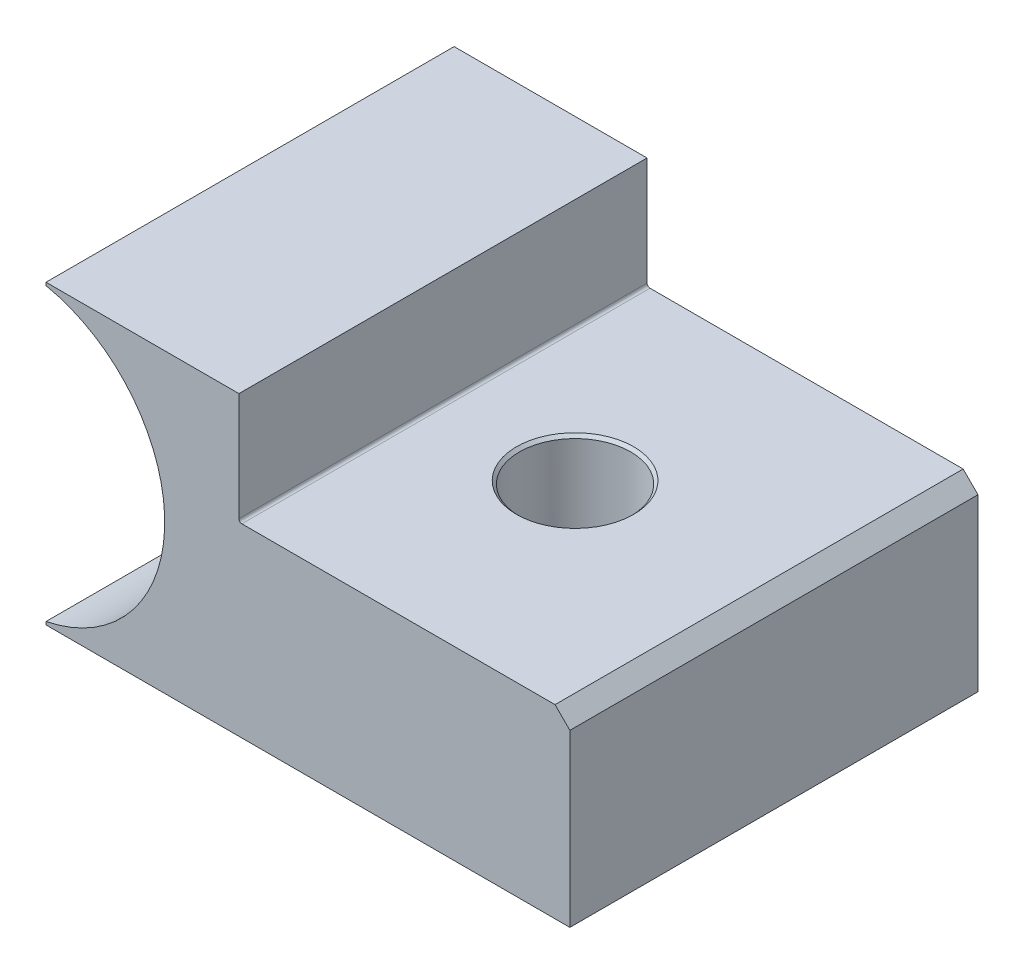
from build123d import *

# Parameters (mm, degrees)
BOSS_EXTRUDE1_DEPTH          = 34.925
F_3_8_0_375_DIAMETER_HOLE1_D = 9.525
CHAMFER1_SIZE                = 1.27
CHAMFER2_SIZE                = 0.254
FILLET1_R                    = 0.254


with BuildPart() as part:
    # Sketch1 → Boss-Extrude1 (new body)
    with BuildSketch(Plane.XY):
        with BuildLine():
            Line((2.54, 0), (47.371, 0))
            Line((47.371, 0), (47.371, 15.875))
            Line((47.371, 15.875), (19.05, 15.875))
            Line((19.05, 15.875), (19.05, 25.4))
            Line((19.05, 25.4), (2.54, 25.4))
            Line((2.54, 25.4), (2.54, 25.143407893))
            ThreePointArc((2.54, 25.143407893), (12.7, 12.7), (2.54, 0.256592107))
            Line((2.54, 0.256592107), (2.54, 0))
        make_face()
    extrude(amount=BOSS_EXTRUDE1_DEPTH)

    # 3/8 (0.375) Diameter Hole1 (through all)
    with Locations(Plane(origin=(0, 15.875, 0), x_dir=(1, 0, 0), z_dir=(0, 1, 0))):
        with Locations((30.353, -17.4625)):
            Hole(F_3_8_0_375_DIAMETER_HOLE1_D / 2)

    # Chamfer1
    chamfer1_edges = [part.edges().sort_by_distance(p)[0] for p in [
        (47.371, 15.875, 17.4625),
    ]]
    chamfer(chamfer1_edges, length=CHAMFER1_SIZE)

    # Chamfer2
    chamfer2_edges = [part.edges().sort_by_distance(p)[0] for p in [
        (35.1155, 15.875, 17.4625),
    ]]
    chamfer(chamfer2_edges, length=CHAMFER2_SIZE)

    # Fillet1
    fillet1_edges = [part.edges().sort_by_distance(p)[0] for p in [
        (19.05, 15.875, 17.4625),
    ]]
    fillet(fillet1_edges, radius=FILLET1_R)


solid = part.part
